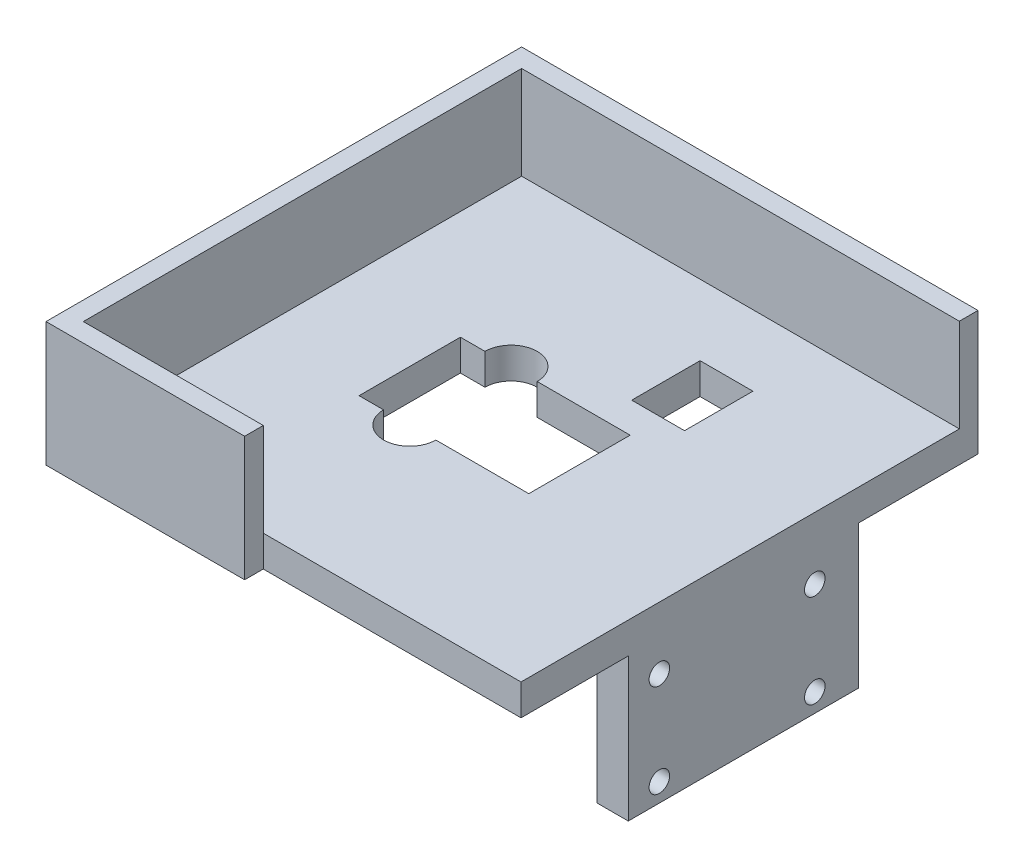
from build123d import *

# Parameters (mm, degrees)
SKETCH_1_W          = 55
SKETCH_1_H          = 70
EXTRUDE_1_DEPTH     = 5
SKETCH_2_W          = 37
SKETCH_2_H          = 28
EXTRUDE_2_DEPTH     = 5
SKETCH_3_R          = 1.65
CUT_EXTRUDE_1_DEPTH = 5
SKETCH_5_W          = 55
SKETCH_5_H          = 15.75
EXTRUDE_3_DEPTH     = 5
SKETCH_6_W          = 55
SKETCH_6_H          = 15.75
CUT_EXTRUDE_2_DEPTH = 5
CUT_EXTRUDE_3_DEPTH = 5
SKETCH_9_W          = 8.5
SKETCH_9_H          = 11
CUT_EXTRUDE_4_DEPTH = 8
SKETCH_11_W         = 15.4
SKETCH_11_H         = 70
EXTRUDE_4_DEPTH     = 5
SKETCH_12_W         = 70.4
SKETCH_12_H         = 0.5
EXTRUDE_5_DEPTH     = 5
SKETCH_14_W         = 70.4
SKETCH_14_H         = 20
EXTRUDE_6_DEPTH     = 3
SKETCH_15_W         = 28.946352296
SKETCH_15_H         = 20
EXTRUDE_7_DEPTH     = 3
SKETCH_16_W         = 76.5
SKETCH_16_H         = 20
EXTRUDE_8_DEPTH     = 3
EXTRUDE_9_DEPTH     = 6


with BuildPart() as part:
    # 草图1 → 凸台-拉伸1 (new body)
    with BuildSketch(Plane(origin=(0, 0, 0), x_dir=(1, 0, 0), z_dir=(0, 1, 0))):
        with Locations((27.5, -35)):
            Rectangle(SKETCH_1_W, SKETCH_1_H)
    extrude(amount=EXTRUDE_1_DEPTH)

    # 草图2 → 凸台-拉伸2 (add)
    with BuildSketch(Plane(origin=(55, 0, 0), x_dir=(0, 0, -1), z_dir=(1, 0, 0))):
        with Locations((-18.5, -9)):
            Rectangle(SKETCH_2_W, SKETCH_2_H)
    extrude(amount=-EXTRUDE_2_DEPTH)

    # 草图3 → 切除-拉伸1 (cut)
    with BuildSketch(Plane(origin=(55, 0, 0), x_dir=(0, 0, -1), z_dir=(1, 0, 0))):
        with Locations((-7, -5)):
            Circle(SKETCH_3_R)
        with Locations((-32, -5)):
            Circle(SKETCH_3_R)
        with Locations((-32, -20)):
            Circle(SKETCH_3_R)
        with Locations((-7, -20)):
            Circle(SKETCH_3_R)
    extrude(amount=-CUT_EXTRUDE_1_DEPTH, mode=Mode.SUBTRACT)

    # 草图5 → 凸台-拉伸3 (add)
    with BuildSketch(Plane(origin=(0, 5, 0), x_dir=(1, 0, 0), z_dir=(0, 1, 0))):
        with Locations((27.5, 7.875)):
            Rectangle(SKETCH_5_W, SKETCH_5_H)
    extrude(amount=-EXTRUDE_3_DEPTH)

    # 草图6 → 切除-拉伸2 (cut)
    with BuildSketch(Plane(origin=(0, 5, 0), x_dir=(1, 0, 0), z_dir=(0, 1, 0))):
        with Locations((27.5, -62.125)):
            Rectangle(SKETCH_6_W, SKETCH_6_H)
    extrude(amount=-CUT_EXTRUDE_2_DEPTH, mode=Mode.SUBTRACT)

    # 草图8 → 切除-拉伸3 (cut)
    with BuildSketch(Plane(origin=(0, 5, 0), x_dir=(1, 0, 0), z_dir=(0, 1, 0))):
        with BuildLine():
            Line((18.4, -11.1), (29.4, -11.1))
            Line((29.4, -11.1), (29.4, -27.4))
            Line((29.4, -27.4), (18.4, -27.4))
            Line((18.4, -27.4), (14.45, -27.4))
            ThreePointArc((14.45, -27.4), (10.25, -31.6), (6.05, -27.4))
            Line((6.05, -27.4), (2.1, -27.4))
            Line((2.1, -27.4), (2.1, -11.1))
            Line((2.1, -11.1), (6.05, -11.1))
            ThreePointArc((6.05, -11.1), (10.25, -6.9), (14.45, -11.1))
            Line((14.45, -11.1), (18.4, -11.1))
        make_face()
    extrude(amount=-CUT_EXTRUDE_3_DEPTH, mode=Mode.SUBTRACT)

    # 草图9 → 切除-拉伸4 (cut)
    with BuildSketch(Plane(origin=(0, 5, 0), x_dir=(1, 0, 0), z_dir=(0, 1, 0))):
        with Locations((28.9, -0.6)):
            Rectangle(SKETCH_9_W, SKETCH_9_H)
    extrude(amount=-CUT_EXTRUDE_4_DEPTH, mode=Mode.SUBTRACT)

    # 草图11 → 凸台-拉伸4 (add)
    with BuildSketch(Plane(origin=(0, 5, 0), x_dir=(1, 0, 0), z_dir=(0, 1, 0))):
        with Locations((-7.7, -19.25)):
            Rectangle(SKETCH_11_W, SKETCH_11_H)
    extrude(amount=-EXTRUDE_4_DEPTH)

    # 草图12 → 凸台-拉伸5 (add)
    with BuildSketch(Plane(origin=(0, 5, 0), x_dir=(1, 0, 0), z_dir=(0, 1, 0))):
        with Locations((19.8, 16)):
            Rectangle(SKETCH_12_W, SKETCH_12_H)
    extrude(amount=-EXTRUDE_5_DEPTH)

    # 草图14 → 凸台-拉伸6 (add)
    with BuildSketch(Plane(origin=(0, 0, -16.25), x_dir=(-1, 0, 0), z_dir=(0, 0, -1))):
        with Locations((-19.8, 10)):
            Rectangle(SKETCH_14_W, SKETCH_14_H)
    extrude(amount=EXTRUDE_6_DEPTH)

    # 草图15 → 凸台-拉伸7 (add)
    with BuildSketch(Plane.XY.offset(54.25)):
        with Locations((-0.926823852, 10)):
            Rectangle(SKETCH_15_W, SKETCH_15_H)
    extrude(amount=EXTRUDE_7_DEPTH)

    # 草图16 → 凸台-拉伸8 (add)
    with BuildSketch(Plane.ZY.offset(15.4)):
        with Locations((19, 10)):
            Rectangle(SKETCH_16_W, SKETCH_16_H)
    extrude(amount=EXTRUDE_8_DEPTH)

    # 草图17 → 凸台-拉伸9 (add, symmetric)
    with BuildSketch(Plane.XY.offset(20)):
        Polygon((31.284916344, 1.075481374), (51.503375842, -12.418628978), (53.208952433, 1.075481374), align=None)
    extrude(amount=EXTRUDE_9_DEPTH, both=True)


solid = part.part
